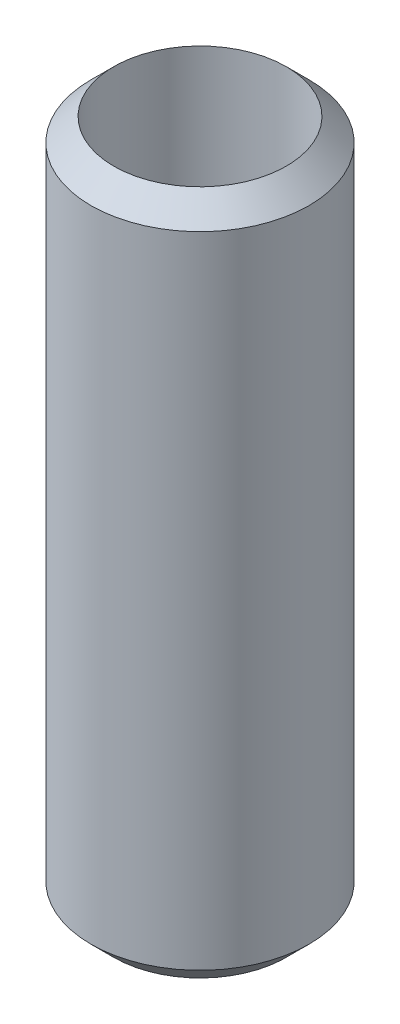
from build123d import *

# Parameters (mm, degrees)
SKETCH1_R           = 22.5
BOSS_EXTRUDE1_DEPTH = 141.739806
SKETCH2_R           = 17.803613723
CUT_EXTRUDE1_DEPTH  = 146.267589658


with BuildPart() as part:
    # Sketch1 → Boss-Extrude1 (new body)
    with BuildSketch(Plane(origin=(0, 0, 0), x_dir=(1, 0, 0), z_dir=(0, 1, 0))):
        with Locations(Location((0, 0, 0), (0, 0, 270))):
            Circle(SKETCH1_R)
    extrude(amount=BOSS_EXTRUDE1_DEPTH)

    # Sketch2 → Cut-Extrude1 (cut, through all)
    with BuildSketch(Plane(origin=(0, 0, 0), x_dir=(1, 0, 0), z_dir=(0, 1, 0))):
        with Locations(Location((0, 0, 0), (0, 0, 270))):
            Circle(SKETCH2_R)
    extrude(amount=CUT_EXTRUDE1_DEPTH, mode=Mode.SUBTRACT)

    # Chamfer1: read off the stored shape, not the designer's step
    # Chamfer1 outline → Chamfer1 (revolve, cut)
    with BuildSketch(Plane.XY):
        Polygon((22.5, 136.88216168), (22.5, 141.73980616), (17.803613723, 141.73980616), (17.803613723, 141.578547956), align=None)
        Polygon((22.5, 4.857644481), (17.803613723, 0.161258204), (17.803613723, 0), (22.5, 0), align=None)
    revolve(axis=Axis((0, 0, 0), (0, 1, 0)), mode=Mode.SUBTRACT)


solid = part.part
